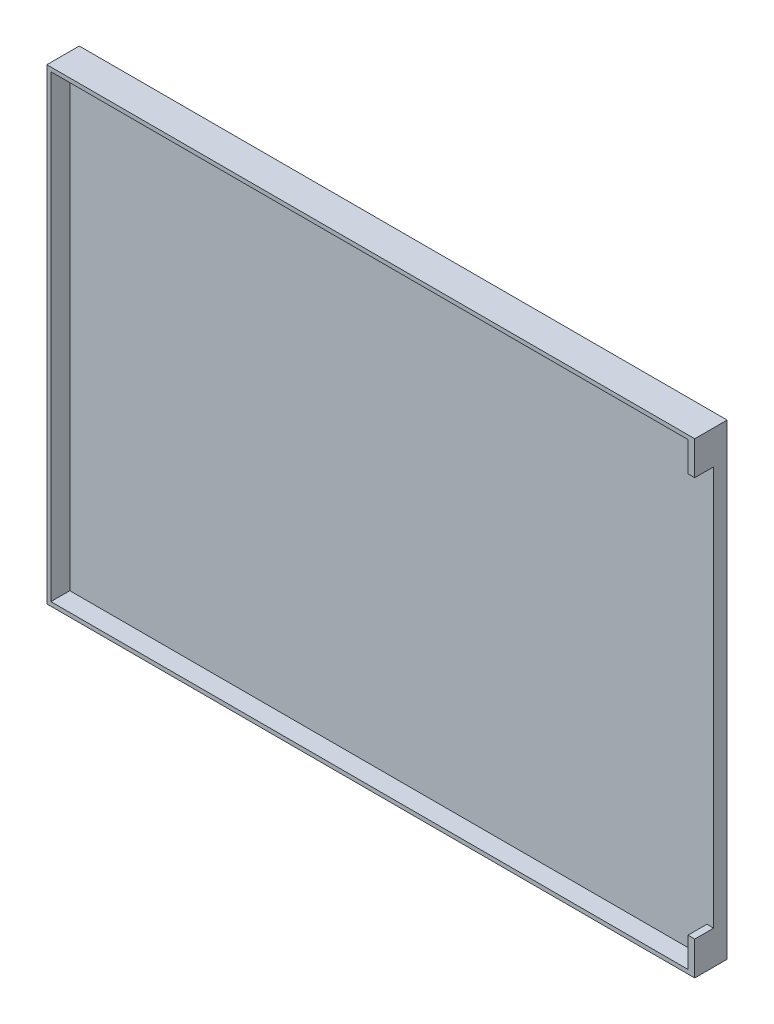
from build123d import *

# Parameters (mm, degrees)
SKETCH_1_W      = 48
SKETCH_1_H      = 34.6
EXTRUDE_1_DEPTH = 1
EXTRUDE_2_DEPTH = 1.4


with BuildPart() as part:
    # Эскиз1 → Бобышка-Вытянуть1 (new body)
    with BuildSketch(Plane.XY):
        Rectangle(SKETCH_1_W, SKETCH_1_H)
    extrude(amount=EXTRUDE_1_DEPTH)

    # Эскиз2 → Бобышка-Вытянуть2 (add)
    with BuildSketch(Plane.XY.offset(1)):
        Polygon((24, 17.3), (-24, 17.3), (-24, -17.3), (24, -17.3), (24, -14.8), (23.5, -14.8), (23.5, -17), (-23.7, -17), (-23.7, 17), (23.5, 17), (23.5, 14.8), (24, 14.8), align=None)
    extrude(amount=EXTRUDE_2_DEPTH)


solid = part.part
